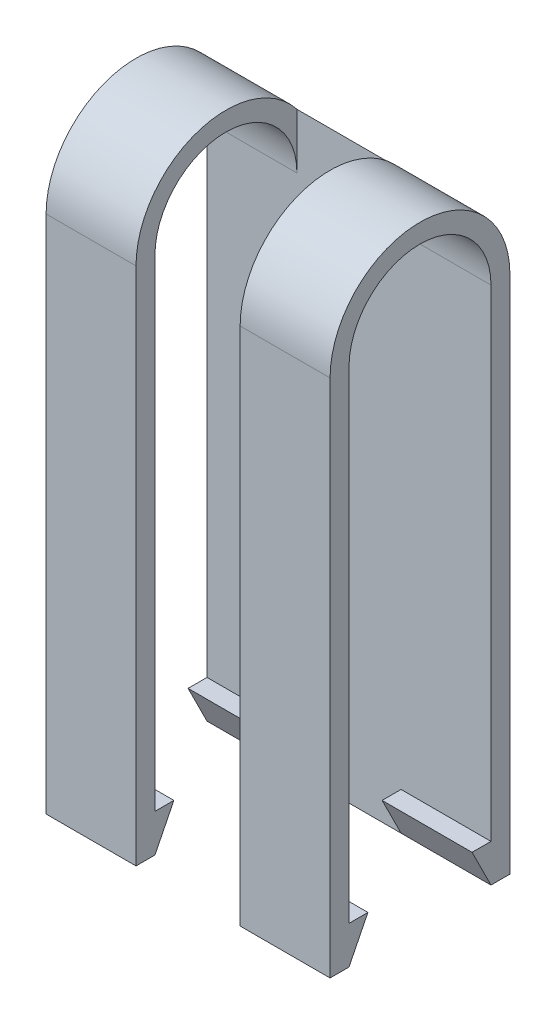
from build123d import *

# Parameters (mm, degrees)
BOSS_EXTRUDE1_DEPTH = 30
SKETCH2_W           = 11
SKETCH2_H           = 64.4
CUT_EXTRUDE1_DEPTH  = 17


with BuildPart() as part:
    # Sketch1 → Boss-Extrude1 (new body)
    with BuildSketch(Plane(origin=(0, 0, 0), x_dir=(0, 0, -1), z_dir=(1, 0, 0))):
        with BuildLine():
            Line((-2, 0), (0, 0))
            Line((0, 0), (2, 4))
            Line((2, 4), (0, 4))
            Line((0, 4), (0, 54.9))
            ThreePointArc((0, 54.9), (7.5, 62.4), (15, 54.9))
            Line((15, 54.9), (15, 4))
            Line((15, 4), (13, 4))
            Line((13, 4), (15, 0))
            Line((15, 0), (17, 0))
            Line((17, 0), (17, 54.9))
            ThreePointArc((17, 54.9), (7.5, 64.4), (-2, 54.9))
            Line((-2, 54.9), (-2, 0))
        make_face()
    extrude(amount=-BOSS_EXTRUDE1_DEPTH)

    # Sketch2 → Cut-Extrude1 (cut)
    with BuildSketch(Plane.XY.offset(2)):
        with Locations((-15, 32.2)):
            Rectangle(SKETCH2_W, SKETCH2_H)
    extrude(amount=-CUT_EXTRUDE1_DEPTH, mode=Mode.SUBTRACT)


solid = part.part
